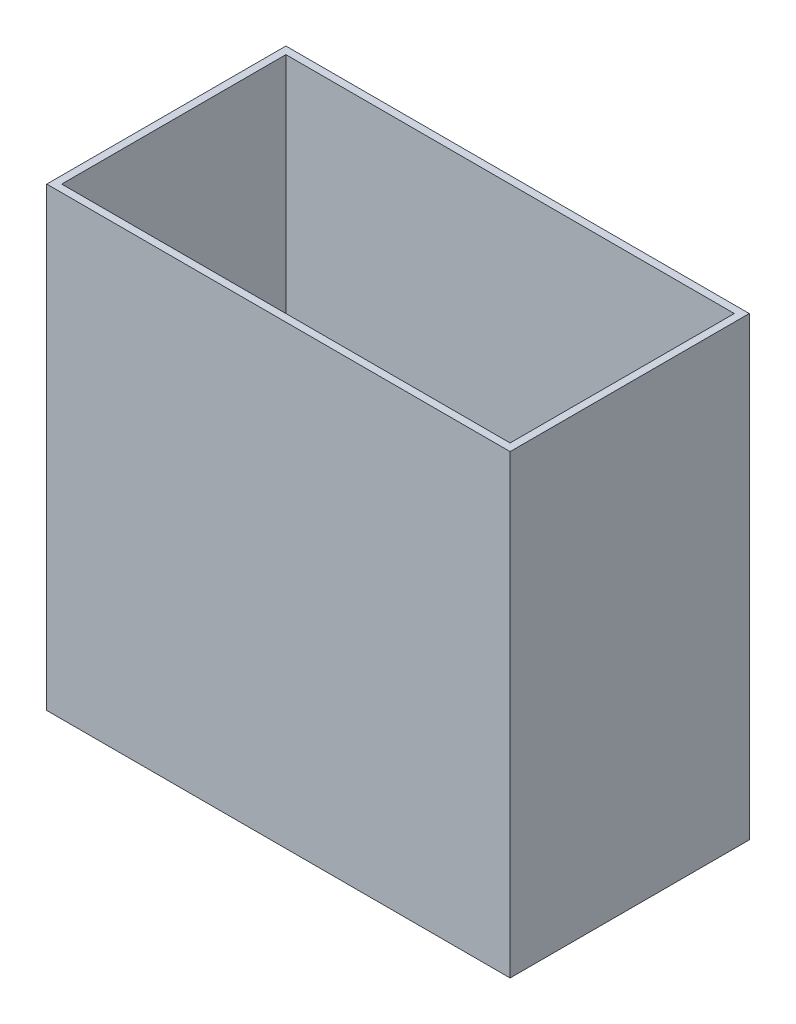
from build123d import *

# Parameters (mm, degrees)
SKETCH1_W           = 60
SKETCH1_H           = 60
BOSS_EXTRUDE1_DEPTH = 30
SHELL1_T            = 1


with BuildPart() as part:
    # Sketch1 → Boss-Extrude1 (new body)
    with BuildSketch(Plane.XY):
        Rectangle(SKETCH1_W, SKETCH1_H)
    extrude(amount=BOSS_EXTRUDE1_DEPTH)

    # Shell1
    shell1_openings = [part.faces().sort_by_distance(p)[0] for p in [
        (0, 30, 15),
    ]]
    offset(amount=SHELL1_T, openings=shell1_openings, kind=Kind.INTERSECTION)


solid = part.part
